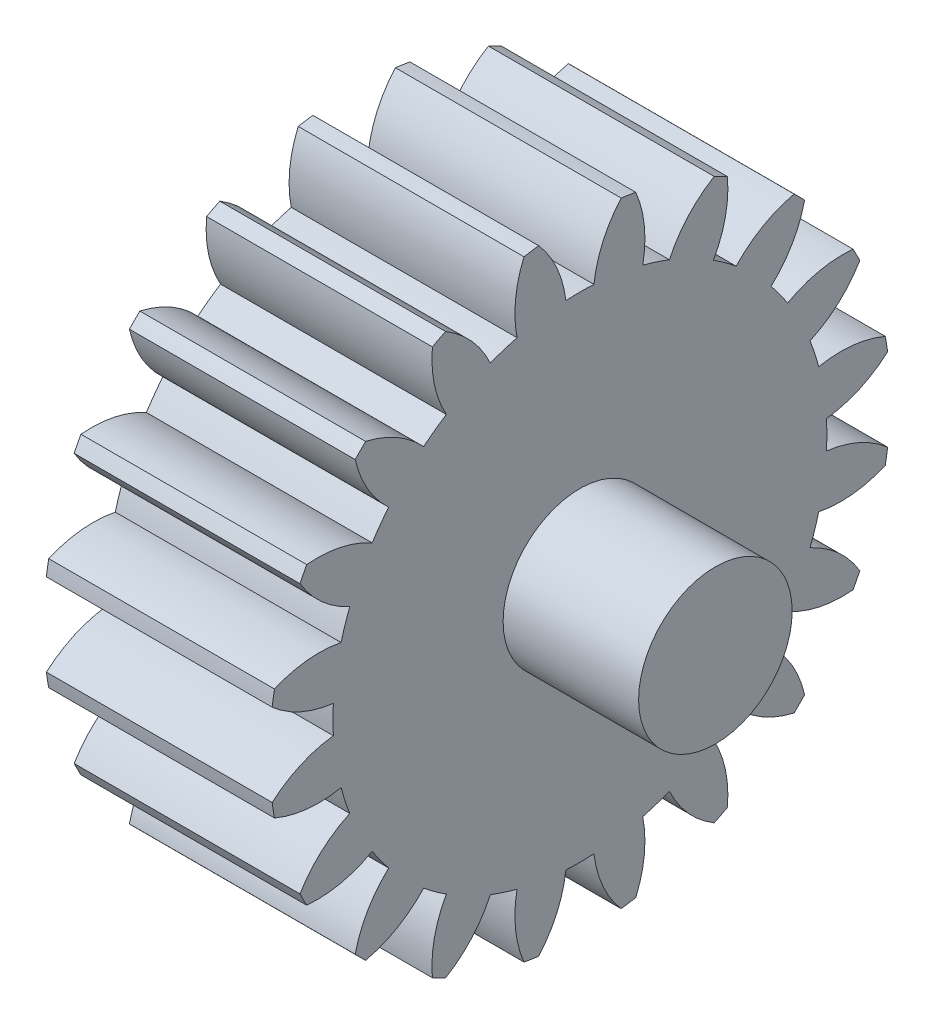
from build123d import *

# Parameters (mm, degrees)
BASPROSKE_W         = 10
BASPROSKE_H         = 13.75
TOOTHCUT_DEPTH      = 22.866069606
TEETHCUTS_COUNT     = 20
TEETHCUTS_ANGLE     = 342
BORSKE_R            = 2
BORE_DEPTH          = 50.0000508
SKETCH2_R           = 2
BOSS_EXTRUDE1_DEPTH = 10
SKETCH3_R           = 3.4
BOSS_EXTRUDE2_DEPTH = 6


with BuildPart() as part:
    # BasProSke → Base-Revolve (revolve)
    with BuildSketch(Plane(origin=(0, 0, 0), x_dir=(1, 0, 0), z_dir=(0, 1, 0))):
        with Locations((5, 6.875)):
            Rectangle(BASPROSKE_W, BASPROSKE_H)
    revolve(axis=Axis((-10, 0, 0), (1, 0, 0)))

    # TooCutSke → ToothCut (cut, through all)
    with BuildSketch(Plane(origin=(0, 0, 0), x_dir=(0, 0, -1), z_dir=(1, 0, 0))):
        with BuildLine():
            ThreePointArc((0.62110296, 10.918848994), (0, 10.9365), (-0.62110296, 10.918848994))
            ThreePointArc((-0.62110296, 10.918848994), (-1.024517052, 12.378857135), (-1.846615859, 13.651067908))
            ThreePointArc((-1.846615859, 13.651067908), (0, 13.7754), (1.846615859, 13.651067908))
            ThreePointArc((1.846615859, 13.651067908), (1.024517052, 12.378857135), (0.62110296, 10.918848994))
        make_face()
    toothcut = extrude(amount=TOOTHCUT_DEPTH, mode=Mode.SUBTRACT)

    # TeethCuts: ToothCut ×20 about axis
    teethcuts_axis = Axis((-10, 0, 0), (1, 0, 0))
    for i in range(1, TEETHCUTS_COUNT):
        add(toothcut.rotate(teethcuts_axis, i * TEETHCUTS_ANGLE / (TEETHCUTS_COUNT - 1)), mode=Mode.SUBTRACT)

    # BorSke → Bore (cut, symmetric)
    with BuildSketch(Plane(origin=(0, 0, 0), x_dir=(0, 0, -1), z_dir=(1, 0, 0))):
        Circle(BORSKE_R)
    extrude(amount=BORE_DEPTH, both=True, mode=Mode.SUBTRACT)

    # Sketch2 → Boss-Extrude1 (add)
    with BuildSketch(Plane(origin=(10, 0, 0), x_dir=(0, 0, -1), z_dir=(1, 0, 0))):
        Circle(SKETCH2_R)
    extrude(amount=-BOSS_EXTRUDE1_DEPTH)

    # Sketch3 → Boss-Extrude2 (add)
    with BuildSketch(Plane(origin=(10, 0, 0), x_dir=(0, 0, -1), z_dir=(1, 0, 0))):
        Circle(SKETCH3_R)
    extrude(amount=BOSS_EXTRUDE2_DEPTH)


solid = part.part
